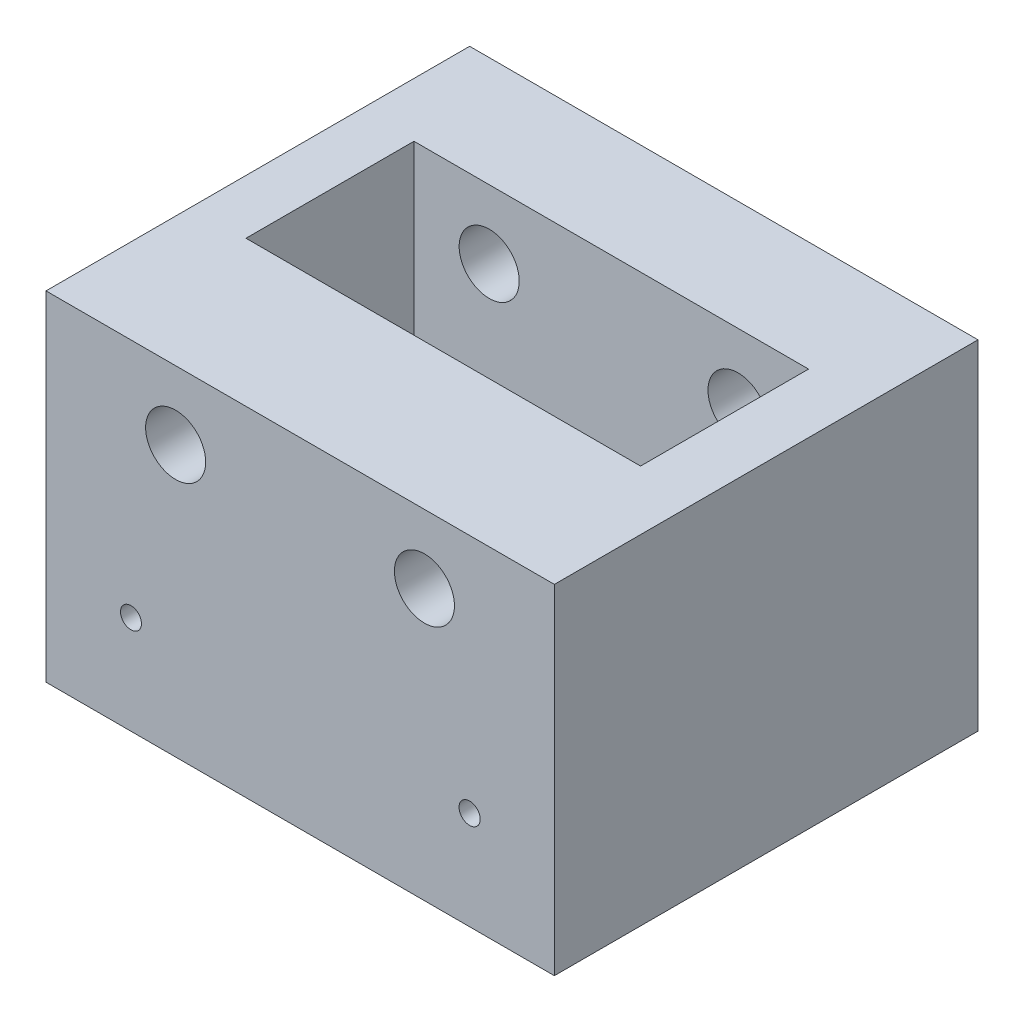
from build123d import *

# Parameters (mm, degrees)
SKETCH2_R           = 8.9999947
SKETCH2_R_2         = 3.175
SKETCH2_R_3         = 3.142219065
BOSS_EXTRUDE1_DEPTH = 127
CUT_EXTRUDE1_DEPTH  = 159.258


with BuildPart() as part:
    # Sketch2 → Boss-Extrude1 (new body)
    with BuildSketch(Plane.XY):
        Polygon((0, 0), (0, 81.061351085), (0, 101.6), (-152.4, 101.6), (-152.4, 81.061351085), (-152.4, 0), align=None)
        with Locations((-113.538, 81.061351085)):
            Circle(SKETCH2_R, mode=Mode.SUBTRACT)
        with Locations((-38.952133661, 81.061351085)):
            Circle(SKETCH2_R, mode=Mode.SUBTRACT)
        with Locations((-25.4, 29.483717051)):
            Circle(SKETCH2_R_2, mode=Mode.SUBTRACT)
        with Locations((-126.923613039, 29.483717051)):
            Circle(SKETCH2_R_3, mode=Mode.SUBTRACT)
    extrude(amount=BOSS_EXTRUDE1_DEPTH)

    # Sketch3 → Cut-Extrude1 (cut)
    with BuildSketch(Plane(origin=(0, 101.6, 0), x_dir=(1, 0, 0), z_dir=(0, 1, 0))):
        Polygon((-76.940636985, -32.999934), (-136.085790465, -32.999934), (-136.085790465, -83.363248949), (-76.940636985, -83.363248949), (-17.795483504, -83.363248949), (-17.795483504, -32.999934), align=None)
    extrude(amount=-CUT_EXTRUDE1_DEPTH, mode=Mode.SUBTRACT)


solid = part.part
